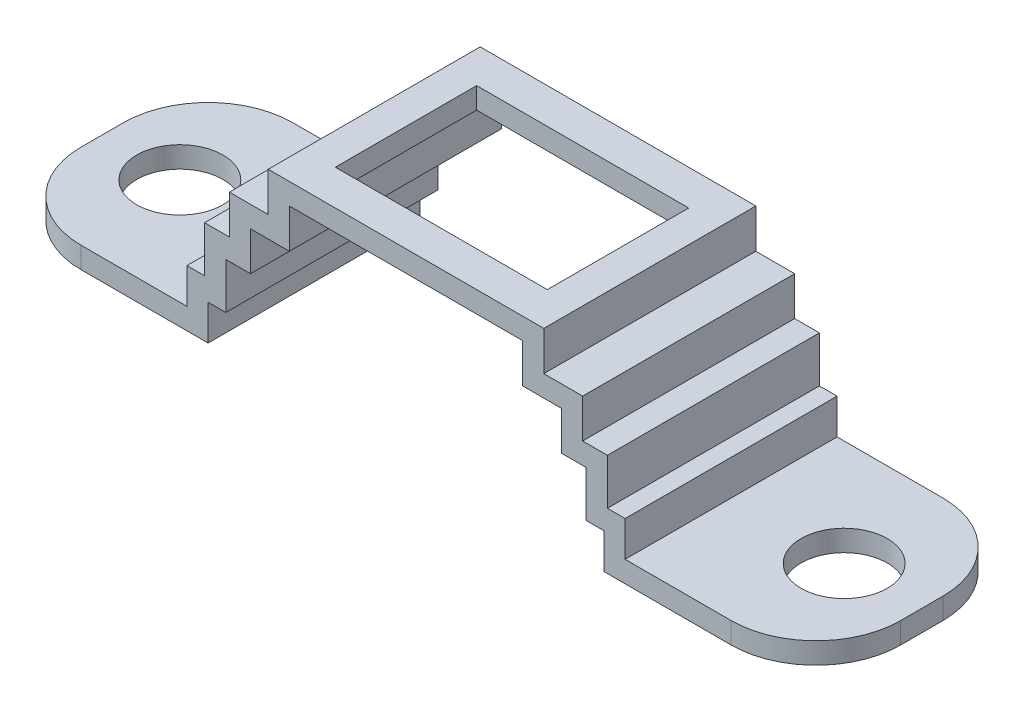
from build123d import *

# Parameters (mm, degrees)
EXTRUDE_THIN1_DEPTH  = 15
SKETCH2_R            = 6.1
CUT_EXTRUDE1_DEPTH   = 65.011737205
FILLET1_R            = 12
FILLET1_OF_MIRROR1_R = 12
SKETCH3_W            = 30
SKETCH3_H            = 20
CUT_EXTRUDE2_DEPTH   = 66.129121751


with BuildPart() as part:
    # Sketch1 → Extrude-Thin1 (new, symmetric)
    with BuildSketch(Plane.XY):
        Polygon((-58, 4.5), (-28, 4.5), (-28, 9.5), (-25.5, 9.5), (-25.5, 16), (-22, 16), (-22, 21.5), (-16.5, 21.5), (-16.5, 27.05), (0, 27.05), (0, 30.05), (-19.5, 30.05), (-19.5, 24.5), (-25, 24.5), (-25, 19), (-28.5, 19), (-28.5, 12.5), (-31, 12.5), (-31, 7.5), (-58, 7.5), align=None)
    extrude_thin1 = extrude(amount=EXTRUDE_THIN1_DEPTH, both=True)

    # Sketch2 → Cut-Extrude1 (cut, through all)
    with BuildSketch(Plane(origin=(0, 7.5, 0), x_dir=(1, 0, 0), z_dir=(0, 1, 0))):
        with Locations((-47, 0)):
            Circle(SKETCH2_R)
    cut_extrude1 = extrude(amount=-CUT_EXTRUDE1_DEPTH, mode=Mode.SUBTRACT)

    # Fillet1
    fillet1_edges = [part.edges().sort_by_distance(p)[0] for p in [
        (-58, 6, -15),
        (-58, 6, 15),
    ]]
    fillet(fillet1_edges, radius=FILLET1_R)

    # Mirror1: Extrude-Thin1, Cut-Extrude1 across plane
    add(extrude_thin1.mirror(Plane(origin=(0, 30.05, 15), x_dir=(0, 0, 1), z_dir=(1, 0, 0))))
    add(cut_extrude1.mirror(Plane(origin=(0, 30.05, 15), x_dir=(0, 0, 1), z_dir=(1, 0, 0))), mode=Mode.SUBTRACT)

    # Fillet1 of Mirror1
    fillet1_of_mirror1_edges = [part.edges().sort_by_distance(p)[0] for p in [
        (58, 6, -15),
        (58, 6, 15),
    ]]
    fillet(fillet1_of_mirror1_edges, radius=FILLET1_OF_MIRROR1_R)

    # Sketch3 → Cut-Extrude2 (cut, through all)
    with BuildSketch(Plane(origin=(0, 30.05, 0), x_dir=(1, 0, 0), z_dir=(0, 1, 0))):
        Rectangle(SKETCH3_W, SKETCH3_H)
    extrude(amount=-CUT_EXTRUDE2_DEPTH, mode=Mode.SUBTRACT)


solid = part.part
